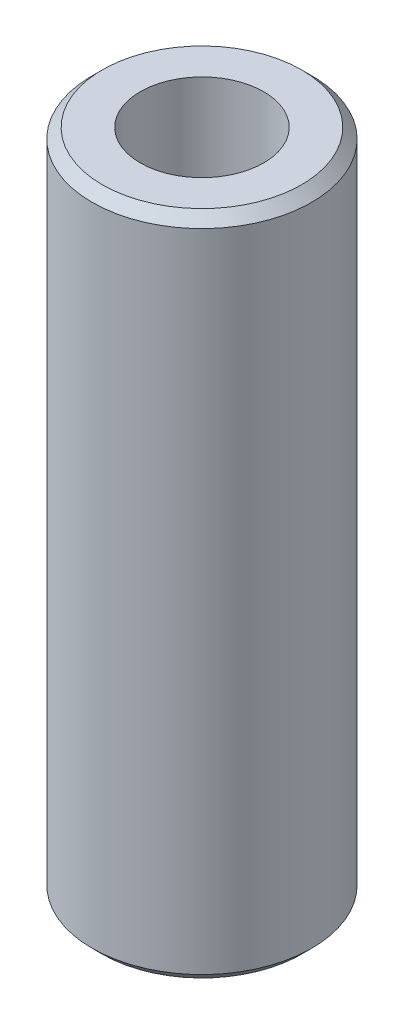
from build123d import *

# Parameters (mm, degrees)
SKETCH1_R           = 47.5
BOSS_EXTRUDE1_DEPTH = 288.393077892
SKETCH2_R           = 26.72046154
CUT_EXTRUDE1_DEPTH  = 297.113267815
CHAMFER1_SIZE       = 4.395312697


with BuildPart() as part:
    # Sketch1 → Boss-Extrude1 (new body)
    with BuildSketch(Plane(origin=(0, 0, 0), x_dir=(1, 0, 0), z_dir=(0, 1, 0))):
        Circle(SKETCH1_R)
    extrude(amount=BOSS_EXTRUDE1_DEPTH)

    # Sketch2 → Cut-Extrude1 (cut, through all)
    with BuildSketch(Plane(origin=(0, 0, 0), x_dir=(1, 0, 0), z_dir=(0, 1, 0))):
        Circle(SKETCH2_R)
    extrude(amount=CUT_EXTRUDE1_DEPTH, mode=Mode.SUBTRACT)

    # Chamfer1
    chamfer1_edges = [part.edges().sort_by_distance(p)[0] for p in [
        (-47.5, 288.393077892, 0),
        (-47.5, 0, 0),
    ]]
    chamfer(chamfer1_edges, length=CHAMFER1_SIZE)


solid = part.part
